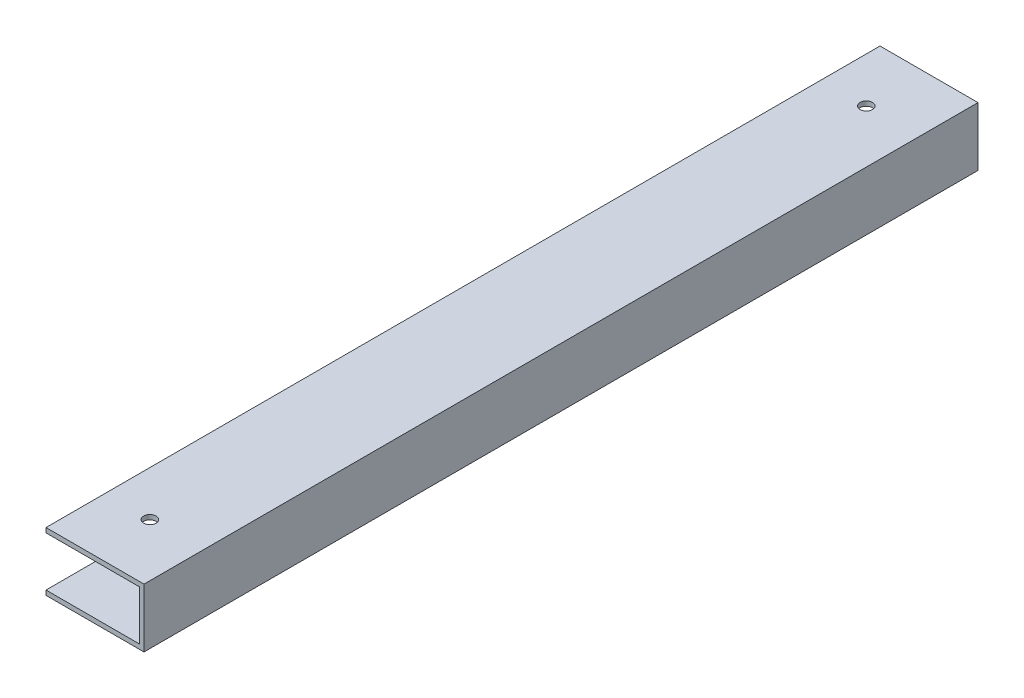
from build123d import *

# Parameters (mm, degrees)
CROQUIS2_W              = 100
CROQUIS2_H              = 60
SALIENTE_EXTRUIR1_DEPTH = 425.5
CROQUIS6_W              = 90.475
CROQUIS6_H              = 50.475
CORTAR_EXTRUIR1_DEPTH   = 900
CROQUIS7_W              = 851
CROQUIS7_H              = 50.475
CORTAR_EXTRUIR2_DEPTH   = 20
CROQUIS8_R              = 6.35
CORTAR_EXTRUIR3_DEPTH   = 80


with BuildPart() as part:
    # Croquis2 → Saliente-Extruir1 (new, symmetric)
    with BuildSketch(Plane.XY):
        Rectangle(CROQUIS2_W, CROQUIS2_H)
    extrude(amount=SALIENTE_EXTRUIR1_DEPTH, both=True)

    # Croquis6 → Cortar-Extruir1 (cut)
    with BuildSketch(Plane.XY.offset(425.5)):
        Rectangle(CROQUIS6_W, CROQUIS6_H)
    extrude(amount=-CORTAR_EXTRUIR1_DEPTH, mode=Mode.SUBTRACT)

    # Croquis7 → Cortar-Extruir2 (cut)
    with BuildSketch(Plane.ZY.offset(50)):
        Rectangle(CROQUIS7_W, CROQUIS7_H)
    extrude(amount=-CORTAR_EXTRUIR2_DEPTH, mode=Mode.SUBTRACT)

    # Croquis8 → Cortar-Extruir3 (cut)
    with BuildSketch(Plane(origin=(0, 30, 0), x_dir=(1, 0, 0), z_dir=(0, 1, 0))):
        with Locations((-4, 365.5)):
            Circle(CROQUIS8_R)
        with Locations((-4, -365.5)):
            Circle(CROQUIS8_R)
    extrude(amount=-CORTAR_EXTRUIR3_DEPTH, mode=Mode.SUBTRACT)


solid = part.part
